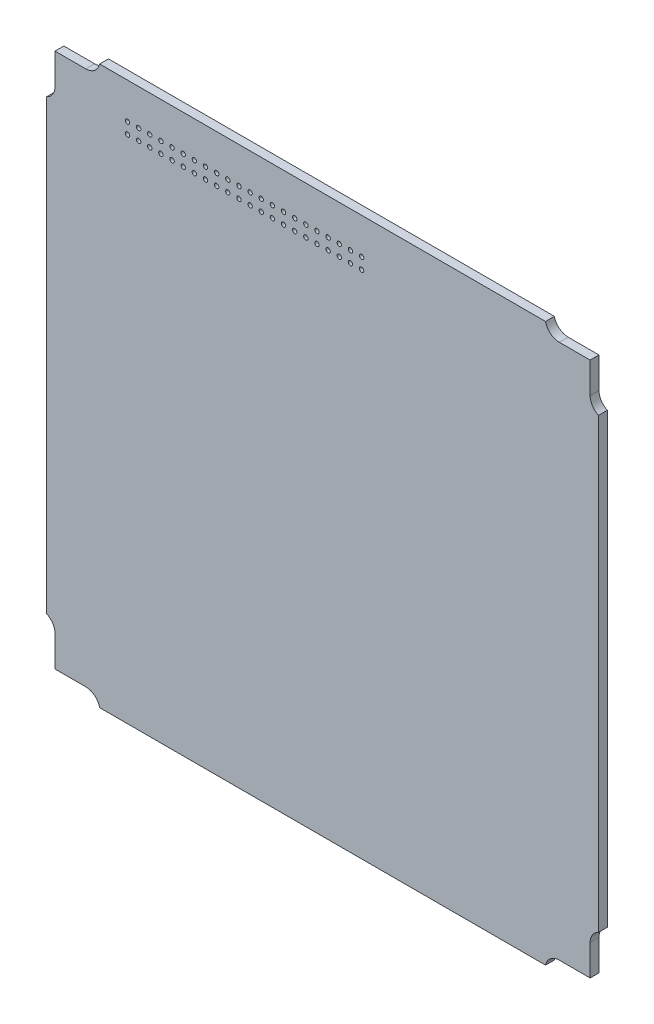
from build123d import *

# Parameters (mm, degrees)
BOSS_EXTRUDE1_DEPTH = 1.5875
FILLET1_R           = 2.54
SKETCH5_R           = 0.395
CUT_EXTRUDE1_DEPTH  = 71.728496069
SKETCH6_OUTSIDE_W   = 130.286
SKETCH6_OUTSIDE_H   = 130.286
SKETCH6_OUTSIDE_W_2 = 99
SKETCH6_OUTSIDE_H_2 = 100
CUT_EXTRUDE2_DEPTH  = 71.728496069


with BuildPart() as part:
    # Sketch1 → Boss-Extrude1 (new body)
    with BuildSketch(Plane.XY):
        Polygon((40, 50), (-40, 50), (-40, 48), (-48, 48), (-48, 40), (-50, 40), (-50, -37.864895224), (-50, -40), (-48, -40), (-48, -48), (-40, -48), (-40, -50), (-37.864895224, -50), (40, -50), (40, -48), (48, -48), (48, -40), (50, -40), (50, 40), (48, 40), (48, 48), (40, 48), align=None)
    extrude(amount=BOSS_EXTRUDE1_DEPTH)

    # Fillet1
    # the kernel refuses this fillet: 2.54 mm, written as the material it adds along each edge
    with BuildSketch(Plane(origin=(-48, -40, 0), x_dir=(0, -1, 0), z_dir=(0, 0, 1)), Plane(origin=(40, -48, 0), x_dir=(1, 0, 0), z_dir=(0, 0, 1)), Plane(origin=(48, 40, 0), x_dir=(0, 1, 0), z_dir=(0, 0, 1)), Plane(origin=(-40, 48, 0), x_dir=(-1, 0, 0), z_dir=(0, 0, 1))) as fillet1_piece_1:
        with BuildLine():
            CenterArc((2.481934729, -2.54), FILLET1_R, 90, 77.725329785)
            Line((0, -2), (-0.049638695, -1.9892))
            ThreePointArc((-0.049638695, -1.9892), (-0.0508, -1), (-0.0508, 0))
            Line((-0.0508, 0), (0, 0.0508))
            Line((0, 0.0508), (2.481934729, 0.0508))
            Line((2.481934729, 0.0508), (2.481934729, 0))
        make_face()
    extrude(amount=1.5875)
    with BuildSketch(Plane(origin=(-40, -48, 0), x_dir=(-3.737454790095179e-12, -1.0, 0), z_dir=(0, 0, 1)), Plane(origin=(48, -40, 0), x_dir=(1.0, -3.7339020764163554e-12, 0), z_dir=(0, 0, 1)), Plane(origin=(-48, 40, 0), x_dir=(-1.0, 3.737454790095126e-12, 0), z_dir=(0, 0, 1))) as fillet1_piece_2:
        with BuildLine():
            CenterArc((2.54, -2.481934729), FILLET1_R, 102.274670215, 77.725329785)
            Line((0, -2.481934729), (-0.0508, -2.481934729))
            Line((-0.0508, -2.481934729), (-0.0508, 0))
            Line((-0.0508, 0), (0, 0.0508))
            ThreePointArc((0, 0.0508), (1, 0.0508), (1.9892, 0.049638695))
            Line((1.9892, 0.049638695), (2, 0))
        make_face()
    extrude(amount=1.5875)
    with BuildSketch(Plane(origin=(40, 48, 0), x_dir=(1, 0, 0), z_dir=(0, 0, 1))) as fillet1_piece_3:
        with BuildLine():
            CenterArc((2.481934729, 2.54), FILLET1_R, 192.274670215, 77.725329785)
            Line((0, 2), (-0.049638695, 1.9892))
            ThreePointArc((-0.049638695, 1.9892), (-0.0508, 1), (-0.0508, 0))
            Line((-0.0508, 0), (0, -0.0508))
            Line((0, -0.0508), (2.481934729, -0.0508))
            Line((2.481934729, -0.0508), (2.481934729, 0))
        make_face()
    extrude(amount=1.5875)

    # Sketch5 → Cut-Extrude1 (cut, through all)
    with BuildSketch(Plane.XY.offset(1.5875)):
        with Locations((-35, 43.55)):
            Circle(SKETCH5_R)
        with Locations((-33, 43.55)):
            Circle(SKETCH5_R)
        with Locations((-31, 43.55)):
            Circle(SKETCH5_R)
        with Locations((-29, 43.55)):
            Circle(SKETCH5_R)
        with Locations((-27, 43.55)):
            Circle(SKETCH5_R)
        with Locations((-25, 43.55)):
            Circle(SKETCH5_R)
        with Locations((-23, 43.55)):
            Circle(SKETCH5_R)
        with Locations((-21, 43.55)):
            Circle(SKETCH5_R)
        with Locations((-19, 43.55)):
            Circle(SKETCH5_R)
        with Locations((-17, 43.55)):
            Circle(SKETCH5_R)
        with Locations((-15, 43.55)):
            Circle(SKETCH5_R)
        with Locations((-13, 43.55)):
            Circle(SKETCH5_R)
        with Locations((-11, 43.55)):
            Circle(SKETCH5_R)
        with Locations((-9, 43.55)):
            Circle(SKETCH5_R)
        with Locations((-7, 43.55)):
            Circle(SKETCH5_R)
        with Locations((-5, 43.55)):
            Circle(SKETCH5_R)
        with Locations((-3, 43.55)):
            Circle(SKETCH5_R)
        with Locations((-1, 43.55)):
            Circle(SKETCH5_R)
        with Locations((1, 43.55)):
            Circle(SKETCH5_R)
        with Locations((3, 43.55)):
            Circle(SKETCH5_R)
        with Locations((5, 43.55)):
            Circle(SKETCH5_R)
        with Locations((7, 43.55)):
            Circle(SKETCH5_R)
        with Locations((-33, 41.55)):
            Circle(SKETCH5_R)
        with Locations((-31, 41.55)):
            Circle(SKETCH5_R)
        with Locations((-29, 41.55)):
            Circle(SKETCH5_R)
        with Locations((-27, 41.55)):
            Circle(SKETCH5_R)
        with Locations((-25, 41.55)):
            Circle(SKETCH5_R)
        with Locations((-23, 41.55)):
            Circle(SKETCH5_R)
        with Locations((-21, 41.55)):
            Circle(SKETCH5_R)
        with Locations((-19, 41.55)):
            Circle(SKETCH5_R)
        with Locations((-17, 41.55)):
            Circle(SKETCH5_R)
        with Locations((-15, 41.55)):
            Circle(SKETCH5_R)
        with Locations((-13, 41.55)):
            Circle(SKETCH5_R)
        with Locations((-11, 41.55)):
            Circle(SKETCH5_R)
        with Locations((-9, 41.55)):
            Circle(SKETCH5_R)
        with Locations((-7, 41.55)):
            Circle(SKETCH5_R)
        with Locations((-5, 41.55)):
            Circle(SKETCH5_R)
        with Locations((-3, 41.55)):
            Circle(SKETCH5_R)
        with Locations((-1, 41.55)):
            Circle(SKETCH5_R)
        with Locations((1, 41.55)):
            Circle(SKETCH5_R)
        with Locations((3, 41.55)):
            Circle(SKETCH5_R)
        with Locations((5, 41.55)):
            Circle(SKETCH5_R)
        with Locations((7, 41.55)):
            Circle(SKETCH5_R)
        with Locations((-35, 41.55)):
            Circle(SKETCH5_R)
    extrude(amount=-CUT_EXTRUDE1_DEPTH, mode=Mode.SUBTRACT)

    # Sketch6 outside → Cut-Extrude2 (cut, through all)
    with BuildSketch(Plane.XY.offset(1.5875)):
        Rectangle(SKETCH6_OUTSIDE_W, SKETCH6_OUTSIDE_H)
        Rectangle(SKETCH6_OUTSIDE_W_2, SKETCH6_OUTSIDE_H_2, mode=Mode.SUBTRACT)
    extrude(amount=-CUT_EXTRUDE2_DEPTH, mode=Mode.SUBTRACT)


solid = part.part
